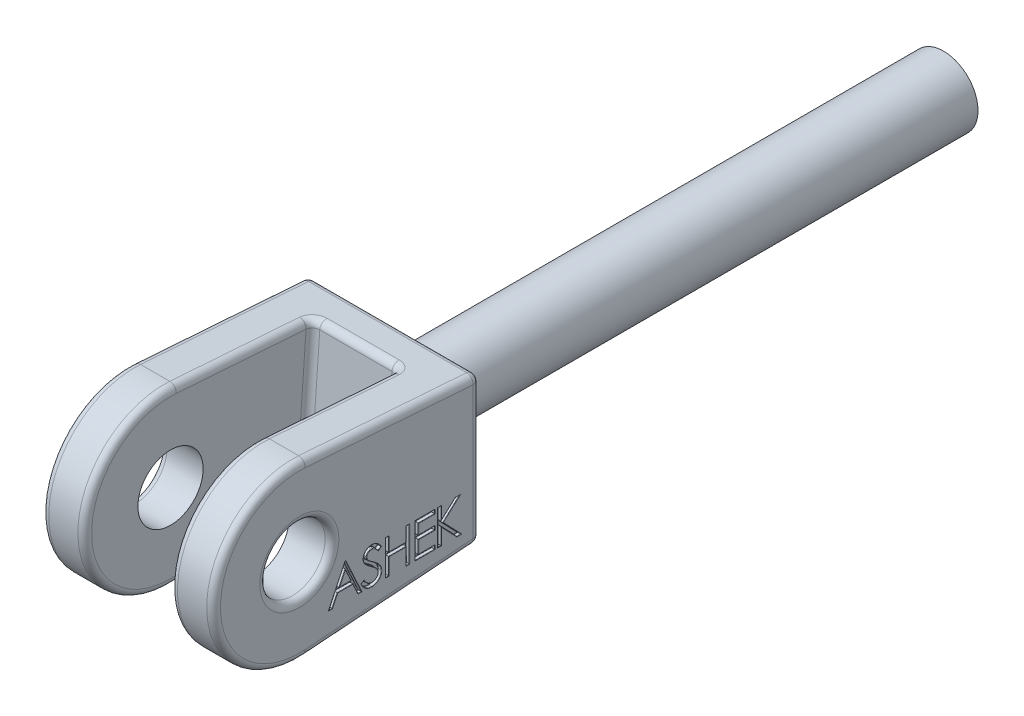
from build123d import *

# Parameters (mm, degrees)
SKETCH1_R           = 1
BOSS_EXTRUDE1_DEPTH = 16
SKETCH2_R           = 0.95
BOSS_EXTRUDE2_DEPTH = 2.5
SKETCH3_W           = 2.5
SKETCH3_H           = 7.980058368
CUT_EXTRUDE1_DEPTH  = 9
FILLET1_R           = 0.2
FILLET2_R           = 0.2
CUT_EXTRUDE2_DEPTH  = 0.1
FILLET3_R           = 0.01


with BuildPart() as part:
    # Sketch1 → Boss-Extrude1 (new body)
    with BuildSketch(Plane.XY):
        Circle(SKETCH1_R)
    extrude(amount=-BOSS_EXTRUDE1_DEPTH)

    # Sketch2 → Boss-Extrude2 (add, symmetric)
    with BuildSketch(Plane(origin=(0, 0, 0), x_dir=(0, 0, -1), z_dir=(1, 0, 0))):
        with BuildLine():
            Line((0, -2.125), (0, 2.125))
            Line((0, 2.125), (-5.074464345, 2.49))
            ThreePointArc((-5.074464345, 2.49), (-7.75, 0), (-5.074464345, -2.49))
            Line((-5.074464345, -2.49), (0, -2.125))
        make_face()
        with Locations((-5.253566993, 0)):
            Circle(SKETCH2_R, mode=Mode.SUBTRACT)
    extrude(amount=BOSS_EXTRUDE2_DEPTH, both=True)

    # Sketch3 → Cut-Extrude1 (cut)
    with BuildSketch(Plane(origin=(0, 2.114062373, -0.152061915), x_dir=(1, 0, 0), z_dir=(0, 0.9974231205170734, -0.0717434224022235))):
        with Locations((0, -5.240029184)):
            Rectangle(SKETCH3_W, SKETCH3_H)
    extrude(amount=-CUT_EXTRUDE1_DEPTH, mode=Mode.SUBTRACT)

    # Fillet1
    fillet1_edges = [part.edges().sort_by_distance(p)[0] for p in [
        (-1.25, 0, 7.75),
        (1.25, 0, 7.75),
        (0, -2.125, 0),
        (-1.25, -2.358331726, 3.24392747),
        (1.25, -2.358331726, 3.24392747),
        (-1.25, 2.346870825, 3.084590665),
        (0, 2.125, 0),
        (1.25, 2.346870825, 3.084590665),
        (-2.5, 0, 6.203566993),
        (-2.5, 0, 7.75),
        (-2.5, -2.3075, 2.537232173),
        (-2.5, 0, 0),
        (-2.5, 2.3075, 2.537232173),
        (2.5, 0, 6.203566993),
        (2.5, 0, 0),
        (2.5, -2.3075, 2.537232173),
        (2.5, 0, 7.75),
        (2.5, 2.3075, 2.537232173),
        (0, -2.226663453, 1.413390594),
        (-1.25, -0.011460901, 1.25405379),
        (0, 2.203741651, 1.094716986),
        (1.25, -0.011460901, 1.25405379),
    ]]
    fillet(fillet1_edges, radius=FILLET1_R)

    # Fillet2
    fillet2_edges = [part.edges().sort_by_distance(p)[0] for p in [
        (-1, 0, 0),
    ]]
    fillet(fillet2_edges, radius=FILLET2_R)

    # Sketch4 → Cut-Extrude2 (cut)
    # profile 1 of 5: a face of its own
    with BuildSketch(Plane(origin=(2.5, 0, 0), x_dir=(0, 0, -1), z_dir=(1, 0, 0))):
        Polygon((-3.906032416, -0.65185178), (-3.444493954, -1.65185178), (-3.542050044, -1.65185178), (-3.689886583, -1.331338959), (-4.143211903, -1.331338959), (-4.295255172, -1.65185178), (-4.393211903, -1.65185178), (-3.918852929, -0.65185178), align=None)
        Polygon((-3.913444275, -0.846763639), (-4.094534018, -1.228774857), (-3.737162224, -1.228774857), align=None, mode=Mode.SUBTRACT)
    # profile 2 of 5: a face of its own
    with BuildSketch(Plane(origin=(2.5, 0, 0), x_dir=(0, 0, -1), z_dir=(1, 0, 0))):
        with BuildLine():
            Line((-3.452186262, -1.458943126), (-3.367651006, -1.408262036))
            add(Edge.make_bspline(
                [(-3.367651006, -1.408262036), (-3.359788652, -1.421423289), (-3.344724686, -1.446639741), (-3.319595726, -1.480713467), (-3.293557752, -1.509674084), (-3.266417942, -1.533353114), (-3.238341957, -1.551995653), (-3.209146513, -1.565196291), (-3.178929996, -1.573429427), (-3.158366047, -1.574429452), (-3.148099724, -1.574928703)],
                knots=[0, 0, 0, 0, 1.272034388, 2.437168799, 3.508375237, 4.49857839, 5.41946034, 6.295179144, 7.148887113, 8, 8, 8, 8], degree=3))
            add(Edge.make_bspline(
                [(-3.148099724, -1.574928703), (-3.139332049, -1.574684511), (-3.121950114, -1.574200399), (-3.096360902, -1.569548741), (-3.071508958, -1.562402419), (-3.04790649, -1.552167867), (-3.025879172, -1.539785442), (-3.006562973, -1.524829392), (-2.989864084, -1.508084762), (-2.976204337, -1.489404003), (-2.965724327, -1.469313389), (-2.95766945, -1.448691689), (-2.953199429, -1.427214955), (-2.952526071, -1.412754823), (-2.952186262, -1.405457549)],
                knots=[0, 0, 0, 0, 1.095163259, 2.171163733, 3.241058638, 4.321873601, 5.38011039, 6.391990106, 7.366004449, 8.327778327, 9.272591725, 10.192022065, 11.087607919, 12, 12, 12, 12], degree=3))
            add(Edge.make_bspline(
                [(-2.952186262, -1.405457549), (-2.952607494, -1.397131592), (-2.953463796, -1.380206138), (-2.960701362, -1.355234808), (-2.972086861, -1.330522646), (-2.982590473, -1.31523657), (-2.988043634, -1.307300498)],
                knots=[0, 0, 0, 0, 0.938893495, 1.908633276, 2.914225137, 4, 4, 4, 4], degree=3))
            add(Edge.make_bspline(
                [(-2.988043634, -1.307300498), (-2.992520952, -1.301572834), (-3.001920522, -1.28954832), (-3.018079811, -1.271649681), (-3.037041558, -1.253187276), (-3.05815686, -1.233456117), (-3.082194885, -1.213373889), (-3.108402746, -1.191982952), (-3.137449563, -1.170096788), (-3.157820848, -1.155418912), (-3.168332095, -1.147845369)],
                knots=[0, 0, 0, 0, 0.722233717, 1.516239348, 2.393582979, 3.351407094, 4.387010283, 5.505090956, 6.712668013, 8, 8, 8, 8], degree=3))
            add(Edge.make_bspline(
                [(-3.168332095, -1.147845369), (-3.178853237, -1.140351487), (-3.198968859, -1.126023755), (-3.227099883, -1.104759674), (-3.252255443, -1.085318568), (-3.274323734, -1.067517422), (-3.293295047, -1.051353821), (-3.309318879, -1.036982981), (-3.321987038, -1.024016249), (-3.32903149, -1.015604437), (-3.332194275, -1.011827741)],
                knots=[0, 0, 0, 0, 1.452282411, 2.77665338, 3.964542531, 5.026858415, 5.96415736, 6.766646006, 7.446254459, 8, 8, 8, 8], degree=3))
            add(Edge.make_bspline(
                [(-3.332194275, -1.011827741), (-3.336615002, -1.005941731), (-3.345308955, -0.994366101), (-3.356784957, -0.976273285), (-3.366539003, -0.957752352), (-3.374185384, -0.938753533), (-3.380624304, -0.919543553), (-3.384955141, -0.899871769), (-3.387666969, -0.879826449), (-3.387944679, -0.866336878), (-3.388083698, -0.859584151)],
                knots=[0, 0, 0, 0, 1.068054152, 2.10047183, 3.106115577, 4.101338837, 5.06977816, 6.043150881, 7.020423561, 8, 8, 8, 8], degree=3))
            add(Edge.make_bspline(
                [(-3.388083698, -0.859584151), (-3.387710781, -0.849004216), (-3.386972918, -0.828070483), (-3.38073277, -0.797490246), (-3.370883372, -0.768294127), (-3.357084833, -0.740771174), (-3.339297018, -0.715638037), (-3.318712454, -0.692605612), (-3.294194886, -0.67324316), (-3.267294137, -0.656325429), (-3.237849459, -0.643083736), (-3.206994915, -0.633094885), (-3.174681466, -0.627435097), (-3.152794856, -0.626622878), (-3.141689467, -0.626210754)],
                knots=[0, 0, 0, 0, 1.005424448, 1.989358655, 2.955360095, 3.929531133, 4.905563448, 5.876582895, 6.856512386, 7.866279853, 8.892233794, 9.918561126, 10.94386622, 12, 12, 12, 12], degree=3))
            add(Edge.make_bspline(
                [(-3.141689467, -0.626210754), (-3.129905438, -0.626617197), (-3.106470767, -0.627425483), (-3.071999562, -0.634453349), (-3.038810786, -0.646082113), (-3.01211271, -0.659278872), (-2.991217636, -0.672459277), (-2.975282569, -0.684464941), (-2.959134726, -0.6982864), (-2.942643853, -0.713960471), (-2.926089379, -0.731630971), (-2.909225536, -0.751176882), (-2.892012887, -0.772478755), (-2.880939784, -0.787685755), (-2.875263185, -0.795481587)],
                knots=[0, 0, 0, 0, 1.286793592, 2.559021753, 3.825965368, 5.121522368, 5.803751409, 6.523245864, 7.299691795, 8.125521123, 9.008227632, 9.944561021, 10.946284179, 12, 12, 12, 12], degree=3))
            Line((-2.875263185, -0.795481587), (-2.956392993, -0.856979985))
            add(Edge.make_bspline(
                [(-2.956392993, -0.856979985), (-2.961291831, -0.85066893), (-2.970725847, -0.838515315), (-2.985048557, -0.821494939), (-2.998548171, -0.805947374), (-3.011848285, -0.792443051), (-3.024246466, -0.780242442), (-3.036279906, -0.769796797), (-3.047775435, -0.76100377), (-3.062265981, -0.751619896), (-3.080471044, -0.742318037), (-3.103323768, -0.734446872), (-3.127205561, -0.729716855), (-3.14347117, -0.729091458), (-3.151705493, -0.728774857)],
                knots=[0, 0, 0, 0, 1.181633172, 2.275549214, 3.290209073, 4.226197932, 5.078386478, 5.862611352, 6.581680152, 7.217281963, 8.414376989, 9.595101626, 10.782541182, 12, 12, 12, 12], degree=3))
            add(Edge.make_bspline(
                [(-3.151705493, -0.728774857), (-3.162035928, -0.729121057), (-3.181957198, -0.729788671), (-3.210240123, -0.737080095), (-3.23569553, -0.748560627), (-3.257567692, -0.76465062), (-3.275778257, -0.783713761), (-3.288951245, -0.805650577), (-3.296879863, -0.82987412), (-3.297847372, -0.846771736), (-3.298340108, -0.855377421)],
                knots=[0, 0, 0, 0, 1.14458467, 2.207223713, 3.21896685, 4.227309161, 5.202851033, 6.127160689, 7.046193047, 8, 8, 8, 8], degree=3))
            add(Edge.make_bspline(
                [(-3.298340108, -0.855377421), (-3.298227786, -0.860734986), (-3.298002959, -0.871458877), (-3.294867302, -0.887302141), (-3.290838923, -0.903105381), (-3.284455314, -0.918797547), (-3.27564237, -0.934653078), (-3.264069462, -0.950945003), (-3.24949423, -0.96781692), (-3.23832937, -0.978790455), (-3.232434659, -0.984584151)],
                knots=[0, 0, 0, 0, 0.858281714, 1.717966888, 2.583508476, 3.4729293, 4.427298488, 5.488583878, 6.674047936, 8, 8, 8, 8], degree=3))
            add(Edge.make_bspline(
                [(-3.232434659, -0.984584151), (-3.230245696, -0.986537587), (-3.22504522, -0.991178504), (-3.215537812, -0.998776299), (-3.202982727, -1.008148519), (-3.187707812, -1.019744895), (-3.169431423, -1.033196742), (-3.14815155, -1.048332059), (-3.124105398, -1.065642191), (-3.107041993, -1.077744345), (-3.098019595, -1.084143446)],
                knots=[0, 0, 0, 0, 0.420754252, 0.999615792, 1.744751191, 2.668019286, 3.750313428, 4.999500688, 6.413464383, 8, 8, 8, 8], degree=3))
            add(Edge.make_bspline(
                [(-3.098019595, -1.084143446), (-3.087166477, -1.092040978), (-3.066150918, -1.107333452), (-3.036248753, -1.130309361), (-3.009136236, -1.152780152), (-2.984718178, -1.174602325), (-2.962753347, -1.195610352), (-2.943485427, -1.216056975), (-2.926718089, -1.23579571), (-2.908666884, -1.26110216), (-2.890221793, -1.29218247), (-2.874381362, -1.330261967), (-2.864393263, -1.368489487), (-2.863087116, -1.394182869), (-2.862442672, -1.406859793)],
                knots=[0, 0, 0, 0, 1.163667725, 2.253281268, 3.268753668, 4.215851969, 5.092017293, 5.902905408, 6.650798638, 7.335211899, 8.59617414, 9.77448103, 10.901945474, 12, 12, 12, 12], degree=3))
            add(Edge.make_bspline(
                [(-2.862442672, -1.406859793), (-2.862630426, -1.41582504), (-2.863002287, -1.433581435), (-2.867276834, -1.459654314), (-2.873539596, -1.48497742), (-2.882978805, -1.509237738), (-2.894499708, -1.532879098), (-2.909118636, -1.555281356), (-2.926063689, -1.576940327), (-2.945501907, -1.597278467), (-2.966772165, -1.615948809), (-2.98925322, -1.632557112), (-3.01298187, -1.646405204), (-3.037829389, -1.657705445), (-3.063801485, -1.666543593), (-3.090889423, -1.67294727), (-3.119137855, -1.676877473), (-3.138337993, -1.677285405), (-3.148099724, -1.677492805)],
                knots=[0, 0, 0, 0, 0.983748083, 1.948392443, 2.894712957, 3.844097841, 4.80183111, 5.778335162, 6.776009319, 7.81870978, 8.863265674, 9.881300176, 10.883814829, 11.87499822, 12.874611388, 13.892143829, 14.928324115, 16, 16, 16, 16], degree=3))
            add(Edge.make_bspline(
                [(-3.148099724, -1.677492805), (-3.155652679, -1.677346753), (-3.170663467, -1.677056489), (-3.192866176, -1.674490409), (-3.214620345, -1.670859808), (-3.235652997, -1.665095788), (-3.256235114, -1.658102366), (-3.276277181, -1.649491414), (-3.295788911, -1.639172213), (-3.314879649, -1.627373635), (-3.333500842, -1.613642851), (-3.351477833, -1.597650423), (-3.369400457, -1.579837422), (-3.386739713, -1.559720118), (-3.403846326, -1.537623523), (-3.420383014, -1.513340899), (-3.436692076, -1.487004512), (-3.446925067, -1.468471631), (-3.452186262, -1.458943126)],
                knots=[0, 0, 0, 0, 0.915332311, 1.819136955, 2.706846663, 3.586547465, 4.459518054, 5.340707479, 6.227863349, 7.133153174, 8.059268498, 9.028702269, 10.047606654, 11.120612155, 12.245963614, 13.433783089, 14.680604001, 16, 16, 16, 16], degree=3))
        make_face()
    # profile 3 of 5: a face of its own
    with BuildSketch(Plane(origin=(2.5, 0, 0), x_dir=(0, 0, -1), z_dir=(1, 0, 0))):
        Polygon((-2.741929852, -0.65185178), (-2.652186262, -0.65185178), (-2.652186262, -1.06210819), (-2.139365749, -1.06210819), (-2.139365749, -0.65185178), (-2.049622159, -0.65185178), (-2.049622159, -1.65185178), (-2.139365749, -1.65185178), (-2.139365749, -1.164672293), (-2.652186262, -1.164672293), (-2.652186262, -1.65185178), (-2.741929852, -1.65185178), align=None)
    # profile 4 of 5: a face of its own
    with BuildSketch(Plane(origin=(2.5, 0, 0), x_dir=(0, 0, -1), z_dir=(1, 0, 0))):
        Polygon((-1.877827288, -0.65185178), (-1.313724724, -0.65185178), (-1.313724724, -0.754415882), (-1.788083698, -0.754415882), (-1.788083698, -1.06210819), (-1.313724724, -1.06210819), (-1.313724724, -1.164672293), (-1.788083698, -1.164672293), (-1.788083698, -1.549287677), (-1.313724724, -1.549287677), (-1.313724724, -1.65185178), (-1.877827288, -1.65185178), align=None)
    # profile 5 of 5: a face of its own
    with BuildSketch(Plane(origin=(2.5, 0, 0), x_dir=(0, 0, -1), z_dir=(1, 0, 0))):
        Polygon((-1.218852929, -0.65185178), (-1.129109339, -0.65185178), (-1.129109339, -1.032661075), (-0.712242352, -0.65185178), (-0.584237544, -0.65185178), (-1.075623762, -1.100569728), (-0.545776006, -1.65185178), (-0.665367352, -1.65185178), (-1.129109339, -1.169279664), (-1.129109339, -1.65185178), (-1.218852929, -1.65185178), align=None)
    extrude(amount=-CUT_EXTRUDE2_DEPTH, mode=Mode.SUBTRACT)

    # Fillet3
    fillet3_edges = [part.edges().sort_by_distance(p)[0] for p in [
        (2.4, -1.15185178, 3.675263185),
        (2.4, -1.65185178, 3.493271999),
        (2.4, -1.491595369, 3.615968313),
        (2.4, -1.331338959, 3.916549243),
        (2.4, -1.491595369, 4.219233538),
        (2.4, -1.65185178, 4.344233538),
        (2.4, -1.15185178, 4.156032416),
        (2.4, -0.65185178, 3.912442672),
        (2.4, -1.037769248, 3.825303249),
        (2.4, -1.037769248, 4.003989147),
        (2.4, -1.228774857, 3.915848121),
        (2.45, -1.331338959, 3.689886583),
        (2.5, -1.221424105, 3.072605379),
        (2.5, -1.035517418, 3.166101872),
        (2.5, -0.92702321, 3.279785165),
        (2.5, -0.76147382, 3.25259764),
        (2.5, -0.767875042, 3.038919126),
        (2.5, -0.826230786, 2.915828089),
        (2.5, -0.675566927, 2.987279987),
        (2.5, -0.76147382, 3.25259764),
        (2.5, -0.940472019, 3.37333244),
        (2.5, -1.083954978, 3.253812362),
        (2.5, -1.221424105, 3.072605379),
        (2.5, -1.35351624, 2.962058054),
        (2.5, -1.530290671, 3.013870003),
        (2.5, -1.521914904, 3.27924194),
        (2.5, -1.433602581, 3.409918634),
        (2.5, -1.521914904, 3.27924194),
        (2.5, -1.530290671, 3.013870003),
        (2.5, -1.408262036, 2.652186262),
        (2.5, -1.164672293, 2.395776006),
        (2.5, -1.408262036, 2.139365749),
        (2.5, -1.65185178, 2.094493954),
        (2.5, -1.15185178, 2.049622159),
        (2.5, -0.65185178, 2.094493954),
        (2.5, -0.856979985, 2.139365749),
        (2.5, -1.06210819, 2.395776006),
        (2.5, -0.856979985, 2.652186262),
        (2.5, -0.65185178, 2.697058057),
        (2.5, -1.15185178, 2.741929852),
        (2.5, -1.65185178, 2.697058057),
        (2.5, -1.600569728, 1.313724724),
        (2.5, -1.549287677, 1.550904211),
        (2.5, -1.356979985, 1.788083698),
        (2.5, -1.164672293, 1.550904211),
        (2.5, -1.113390241, 1.313724724),
        (2.5, -1.06210819, 1.550904211),
        (2.5, -0.908262036, 1.788083698),
        (2.5, -0.754415882, 1.550904211),
        (2.5, -0.703133831, 1.313724724),
        (2.5, -0.65185178, 1.595776006),
        (2.5, -1.15185178, 1.877827288),
        (2.5, -1.65185178, 1.595776006),
        (2.5, -1.410565722, 1.129109339),
        (2.5, -1.410565722, 0.897238345),
        (2.5, -1.65185178, 0.605571679),
        (2.5, -1.376210754, 0.810699884),
        (2.5, -0.876210754, 0.829930653),
        (2.5, -0.65185178, 0.648239948),
        (2.5, -0.842256427, 0.920675845),
        (2.5, -0.842256427, 1.129109339),
        (2.5, -0.65185178, 1.173981134),
        (2.5, -1.15185178, 1.218852929),
        (2.5, -1.65185178, 1.173981134),
        (2.5, -1.65185178, 4.344233538),
        (2.5, -1.491595369, 4.219233538),
        (2.5, -1.331338959, 3.916549243),
        (2.5, -1.491595369, 3.615968313),
        (2.5, -1.65185178, 3.493271999),
        (2.5, -1.15185178, 3.675263185),
        (2.5, -0.65185178, 3.912442672),
        (2.5, -1.15185178, 4.156032416),
        (2.5, -1.037769248, 4.003989147),
        (2.5, -1.037769248, 3.825303249),
        (2.5, -1.228774857, 3.915848121),
        (2.4, -0.65185178, 1.173981134),
        (2.4, -0.842256427, 1.129109339),
        (2.4, -0.842256427, 0.920675845),
        (2.4, -0.65185178, 0.648239948),
        (2.4, -0.876210754, 0.829930653),
        (2.4, -1.376210754, 0.810699884),
        (2.4, -1.65185178, 0.605571679),
        (2.4, -1.410565722, 0.897238345),
        (2.4, -1.410565722, 1.129109339),
        (2.4, -1.65185178, 1.173981134),
        (2.4, -1.15185178, 1.218852929),
        (2.4, -0.65185178, 1.595776006),
        (2.4, -0.703133831, 1.313724724),
        (2.4, -0.754415882, 1.550904211),
        (2.4, -0.908262036, 1.788083698),
        (2.4, -1.06210819, 1.550904211),
        (2.4, -1.113390241, 1.313724724),
        (2.4, -1.164672293, 1.550904211),
        (2.4, -1.356979985, 1.788083698),
        (2.4, -1.549287677, 1.550904211),
        (2.4, -1.600569728, 1.313724724),
        (2.4, -1.65185178, 1.595776006),
        (2.4, -1.15185178, 1.877827288),
        (2.4, -0.65185178, 2.697058057),
        (2.4, -0.856979985, 2.652186262),
        (2.4, -1.06210819, 2.395776006),
        (2.4, -0.856979985, 2.139365749),
        (2.4, -0.65185178, 2.094493954),
        (2.4, -1.15185178, 2.049622159),
        (2.4, -1.65185178, 2.094493954),
        (2.4, -1.408262036, 2.139365749),
        (2.4, -1.164672293, 2.395776006),
        (2.4, -1.408262036, 2.652186262),
        (2.4, -1.65185178, 2.697058057),
        (2.4, -1.15185178, 2.741929852),
        (2.4, -1.433602581, 3.409918634),
        (2.4, -1.521914904, 3.27924194),
        (2.4, -1.530290671, 3.013870003),
        (2.4, -1.35351624, 2.962058054),
        (2.4, -1.221424105, 3.072605379),
        (2.4, -1.083954978, 3.253812362),
        (2.4, -0.940472019, 3.37333244),
        (2.4, -0.76147382, 3.25259764),
        (2.4, -0.675566927, 2.987279987),
        (2.4, -0.826230786, 2.915828089),
        (2.4, -0.767875042, 3.038919126),
        (2.4, -0.76147382, 3.25259764),
        (2.4, -0.92702321, 3.279785165),
        (2.4, -1.035517418, 3.166101872),
        (2.4, -1.221424105, 3.072605379),
        (2.4, -1.530290671, 3.013870003),
        (2.4, -1.521914904, 3.27924194),
    ]]
    fillet(fillet3_edges, radius=FILLET3_R)


solid = part.part
